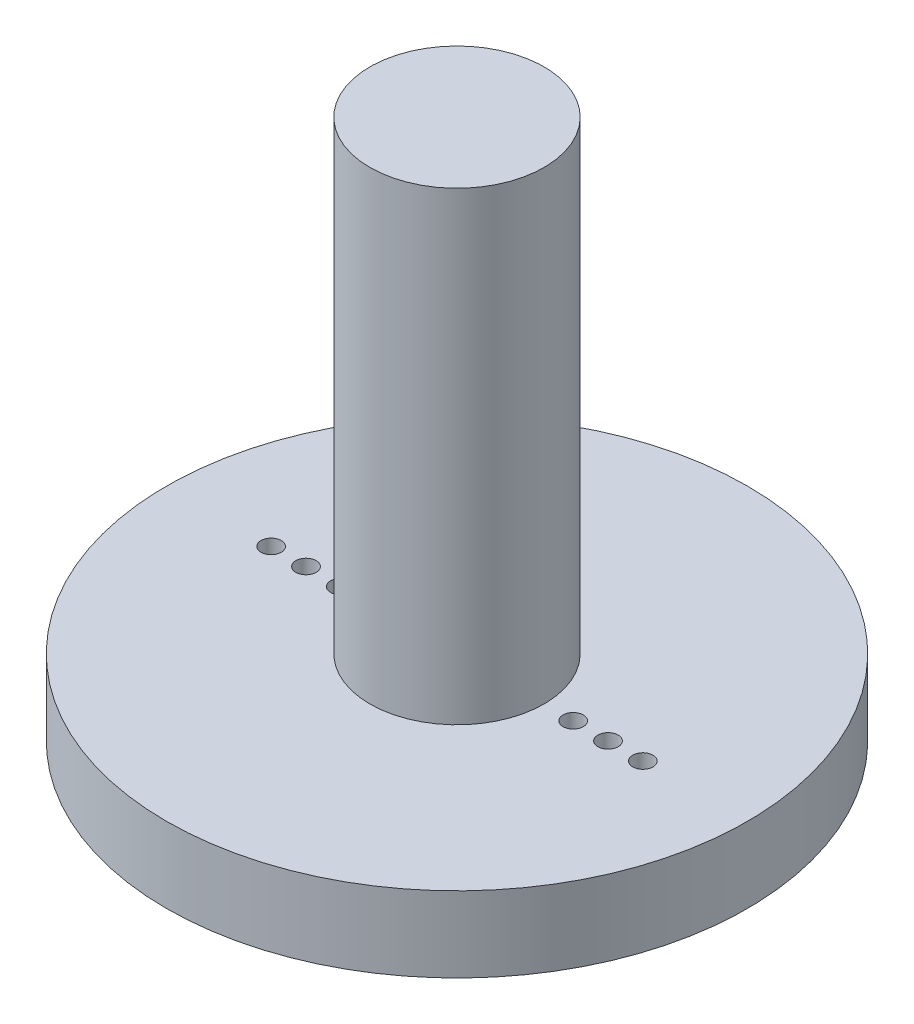
from build123d import *

# Parameters (mm, degrees)
SKETCH1_R             = 25
BOSS_EXTRUDE1_DEPTH   = 6.5
HORN_HOLE_DEPTH       = 2
SCREW_HOLES_REACH     = 37.641
SKETCH9_R             = 0.875
SKETCH11_R            = 7.5
BOSS_EXTRUDE2_DEPTH   = 40
SCREW_HEAD_HOLE_ANGLE = 180


with BuildPart() as part:
    # Sketch1 → Boss-Extrude1 (new body)
    with BuildSketch(Plane(origin=(0, 0, 0), x_dir=(1, 0, 0), z_dir=(0, 1, 0))):
        Circle(SKETCH1_R)
    extrude(amount=BOSS_EXTRUDE1_DEPTH)

    # Sketch8 → Horn Hole (cut)
    with BuildSketch(Plane.XZ):
        with BuildLine():
            ThreePointArc((2.867832451, 6.276606431), (5.55485913, 5.311303559), (8.103473198, 4.024257195))
            ThreePointArc((8.103473198, 4.024257195), (12.790122891, 3.37163327), (17.445502266, 2.524257195))
            ThreePointArc((17.445502266, 2.524257195), (19.894779582, 1.820498395), (21, -0.475742805))
            ThreePointArc((21, -0.475742805), (19.60737188, -2.167378066), (17.445502266, -2.524257195))
            ThreePointArc((17.445502266, -2.524257195), (12.790122891, -3.37163327), (8.103473198, -4.024257195))
            ThreePointArc((8.103473198, -4.024257195), (5.55485913, -5.311303559), (2.867832451, -6.276606431))
            ThreePointArc((2.867832451, -6.276606431), (0, -6.900742805), (-2.867832451, -6.276606431))
            ThreePointArc((-2.867832451, -6.276606431), (-5.55485913, -5.311303559), (-8.103473198, -4.024257195))
            ThreePointArc((-8.103473198, -4.024257195), (-12.780142502, -3.846309279), (-17.445502266, -3.475742805))
            ThreePointArc((-17.445502266, -3.475742805), (-19.894779582, -2.771984005), (-21, -0.475742805))
            ThreePointArc((-21, -0.475742805), (-19.894779582, 1.820498395), (-17.445502266, 2.524257195))
            ThreePointArc((-17.445502266, 2.524257195), (-12.790122891, 3.37163327), (-8.103473198, 4.024257195))
            ThreePointArc((-8.103473198, 4.024257195), (-5.55485913, 5.311303559), (-2.867832451, 6.276606431))
            ThreePointArc((-2.867832451, 6.276606431), (0, 6.900742805), (2.867832451, 6.276606431))
        make_face()
    extrude(amount=-HORN_HOLE_DEPTH, mode=Mode.SUBTRACT)

    # Sketch9 → Screw Holes (cut, up to next)
    with BuildSketch(Plane.XZ.offset(-2), mode=Mode.PRIVATE) as screw_holes_sk1:
        with Locations((10, 0)):
            Circle(SKETCH9_R)
    screw_holes_tool1 = extrude(screw_holes_sk1.sketch, amount=-SCREW_HOLES_REACH, mode=Mode.PRIVATE) & part.part
    # Sketch9 → Screw Holes (cut, up to next)
    with BuildSketch(Plane.XZ.offset(-2), mode=Mode.PRIVATE) as screw_holes_sk2:
        with Locations((13, 0)):
            Circle(SKETCH9_R)
    screw_holes_tool2 = extrude(screw_holes_sk2.sketch, amount=-SCREW_HOLES_REACH, mode=Mode.PRIVATE) & part.part
    # Sketch9 → Screw Holes (cut, up to next)
    with BuildSketch(Plane.XZ.offset(-2), mode=Mode.PRIVATE) as screw_holes_sk3:
        with Locations((16, 0)):
            Circle(SKETCH9_R)
    screw_holes_tool3 = extrude(screw_holes_sk3.sketch, amount=-SCREW_HOLES_REACH, mode=Mode.PRIVATE) & part.part
    # Sketch9 → Screw Holes (cut, up to next)
    with BuildSketch(Plane.XZ.offset(-2), mode=Mode.PRIVATE) as screw_holes_sk4:
        with Locations((-10, 0)):
            Circle(SKETCH9_R)
    screw_holes_tool4 = extrude(screw_holes_sk4.sketch, amount=-SCREW_HOLES_REACH, mode=Mode.PRIVATE) & part.part
    # Sketch9 → Screw Holes (cut, up to next)
    with BuildSketch(Plane.XZ.offset(-2), mode=Mode.PRIVATE) as screw_holes_sk5:
        with Locations((-13, 0)):
            Circle(SKETCH9_R)
    screw_holes_tool5 = extrude(screw_holes_sk5.sketch, amount=-SCREW_HOLES_REACH, mode=Mode.PRIVATE) & part.part
    # Sketch9 → Screw Holes (cut, up to next)
    with BuildSketch(Plane.XZ.offset(-2), mode=Mode.PRIVATE) as screw_holes_sk6:
        with Locations((-16, 0)):
            Circle(SKETCH9_R)
    screw_holes_tool6 = extrude(screw_holes_sk6.sketch, amount=-SCREW_HOLES_REACH, mode=Mode.PRIVATE) & part.part
    add(screw_holes_tool1.solids().sort_by_distance((10, 2, 0))[0], mode=Mode.SUBTRACT)
    add(screw_holes_tool2.solids().sort_by_distance((13, 2, 0))[0], mode=Mode.SUBTRACT)
    add(screw_holes_tool3.solids().sort_by_distance((16, 2, 0))[0], mode=Mode.SUBTRACT)
    add(screw_holes_tool4.solids().sort_by_distance((-10, 2, 0))[0], mode=Mode.SUBTRACT)
    add(screw_holes_tool5.solids().sort_by_distance((-13, 2, 0))[0], mode=Mode.SUBTRACT)
    add(screw_holes_tool6.solids().sort_by_distance((-16, 2, 0))[0], mode=Mode.SUBTRACT)

    # Sketch11 → Boss-Extrude2 (add)
    with BuildSketch(Plane(origin=(0, 6.5, 0), x_dir=(1, 0, 0), z_dir=(0, 1, 0))):
        Circle(SKETCH11_R)
    extrude(amount=BOSS_EXTRUDE2_DEPTH)

    # Sketch13 → Screw Head Hole (revolve, cut)
    with BuildSketch(Plane.XZ.offset(-2)):
        with BuildLine():
            Line((3.4, 0), (-3.4, 0))
            ThreePointArc((-3.4, 0), (0, -3.4), (3.4, 0))
        make_face()
    revolve(axis=Axis((3.4, 2, 0), (1, 0, 0)), revolution_arc=SCREW_HEAD_HOLE_ANGLE, mode=Mode.SUBTRACT)


solid = part.part
